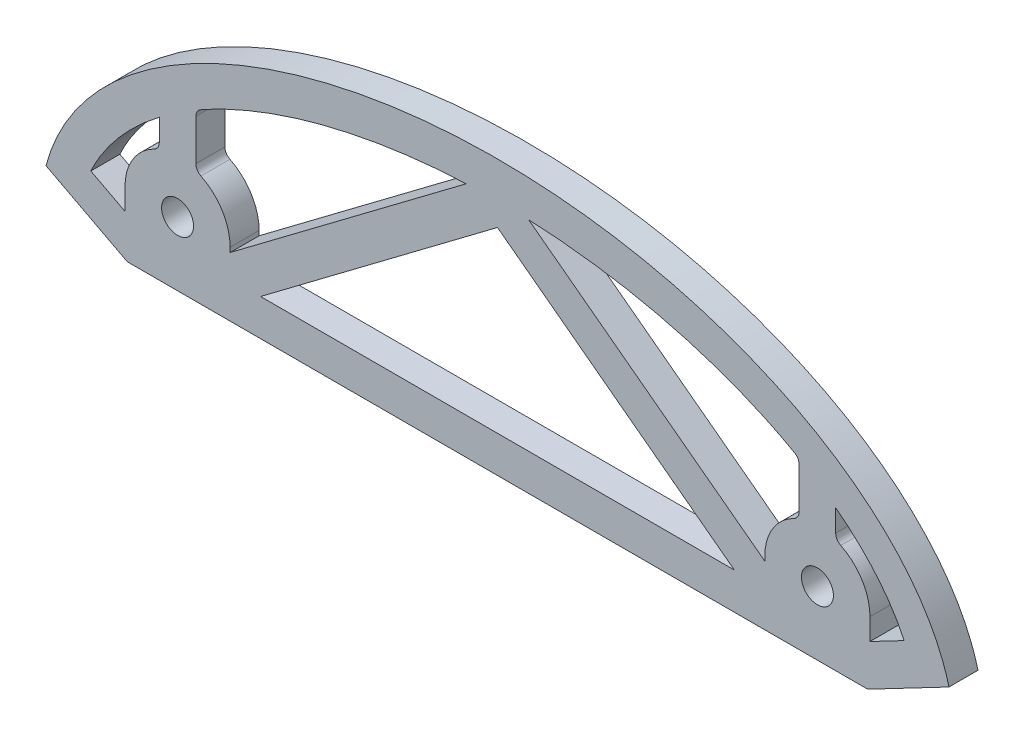
from build123d import *

# Parameters (mm, degrees)
SKETCH1_R               = 1.75
BOSS_EXTRUDE1_DEPTH     = 3.175
CUT_EXTRUDE2_DEPTH      = 104.871351997
CUT_EXTRUDE2_DEPTH_BACK = 104.871351997


with BuildPart() as part:
    # Sketch1 → Boss-Extrude1 (new body)
    with BuildSketch(Plane.XY):
        with BuildLine():
            Line((9.5, 0), (90.5, 0))
            Line((90.5, 0), (99.394049692, 4.65639644))
            add(Edge.make_bspline(
                [(99.394049692, 4.65639644), (92.757517889, 30), (50, 30), (7.242482111, 30), (0.605950308, 4.65639644)],
                knots=[3.309608299, 3.309608299, 3.309608299, 4.71238898, 4.71238898, 6.115169662, 6.115169662, 6.115169662], degree=2, weights=[0.94404498, 0.73843525, 1, 0.73843525, 0.94404498]))
            Line((0.605950308, 4.65639644), (9.5, 0))
        make_face()
        with Locations((15, 7)):
            Circle(SKETCH1_R, mode=Mode.SUBTRACT)
        with BuildLine():
            add(Edge.make_bspline(
                [(9.25, 12.062294005), (6.832522418, 9.453191203), (5.508863565, 6.604554423)],
                knots=[2.659161325, 2.659161325, 2.659161325, 2.884756952, 2.884756952, 2.884756952], degree=2, weights=[1, 0.993645069, 1]))
            Line((9.25, 12.062294005), (9.25, 4.645917471))
            Line((9.25, 4.645917471), (5.508863565, 6.604554423))
        make_face(mode=Mode.SUBTRACT)
        with Locations((85, 7)):
            Circle(SKETCH1_R, mode=Mode.SUBTRACT)
        with BuildLine():
            Line((90.75, 4.645917471), (90.75, 12.062294005))
            add(Edge.make_bspline(
                [(94.491136435, 6.604554423), (93.167477582, 9.453191203), (90.75, 12.062294005)],
                knots=[0.256835702, 0.256835702, 0.256835702, 0.482431329, 0.482431329, 0.482431329], degree=2, weights=[1, 0.993645069, 1]))
            Line((94.491136435, 6.604554423), (90.75, 4.645917471))
        make_face(mode=Mode.SUBTRACT)
        Polygon((75.922724168, 4), (24.077275832, 4), (50, 23.497433562), align=None, mode=Mode.SUBTRACT)
        with BuildLine():
            Line((79.25, 20.066709987), (79.25, 6.502566438))
            Line((79.25, 6.502566438), (53.42312279, 25.92790998))
            add(Edge.make_bspline(
                [(79.25, 20.066709987), (67.982150516, 25.313839283), (53.42312279, 25.92790998)],
                knots=[0.881661652, 0.881661652, 0.881661652, 1.499250046, 1.499250046, 1.499250046], degree=2, weights=[1, 0.897744364, 0.887128136]))
        make_face(mode=Mode.SUBTRACT)
        with BuildLine():
            add(Edge.make_bspline(
                [(46.57687721, 25.92790998), (32.017849484, 25.313839283), (20.75, 20.066709987)],
                knots=[1.642342608, 1.642342608, 1.642342608, 2.259931001, 2.259931001, 2.259931001], degree=2, weights=[0.887128136, 0.897744364, 1]))
            Line((46.57687721, 25.92790998), (20.75, 6.502566438))
            Line((20.75, 6.502566438), (20.75, 20.066709987))
        make_face(mode=Mode.SUBTRACT)
    extrude(amount=BOSS_EXTRUDE1_DEPTH)

    # Sketch2 → Cut-Extrude2 (cut, two sides: drawn at the far end of the back side and taken through both)
    with BuildSketch(Plane.XY.offset(3.175).offset(-CUT_EXTRUDE2_DEPTH_BACK)):
        with BuildLine():
            ThreePointArc((17.555555556, 12.150886895), (19.886560367, 10.030516091), (20.75, 7))
            Line((20.75, 7), (20.75, 20.066709987))
            add(Edge.make_bspline(
                [(20.75, 20.066709987), (19.05937684, 19.279433025), (17.508760006, 18.404916624)],
                knots=[5.400246246, 5.400246246, 5.400246246, 5.496691054, 5.496691054, 5.496691054], degree=2, weights=[0.985365434, 0.99153217, 1]))
            ThreePointArc((17.508760006, 18.404916624), (17.136507095, 18.038253345), (17, 17.53389236))
            Line((17, 17.53389236), (17, 13.046693311))
            ThreePointArc((17, 13.046693311), (17.150163414, 12.519647035), (17.555555556, 12.150886895))
        make_face()
        with BuildLine():
            add(Edge.make_bspline(
                [(13, 15.448126504), (10.894235227, 13.836862164), (9.25, 12.062294005)],
                knots=[5.646965989, 5.646965989, 5.646965989, 5.800753978, 5.800753978, 5.800753978], degree=2, weights=[1, 0.997045113, 1]))
            Line((9.25, 12.062294005), (9.25, 7))
            ThreePointArc((9.25, 7), (10.113439633, 10.030516091), (12.444444444, 12.150886895))
            ThreePointArc((12.444444444, 12.150886895), (12.849836586, 12.519647035), (13, 13.046693311))
            Line((13, 13.046693311), (13, 15.448126504))
        make_face()
        with BuildLine():
            Line((83, 13.046693311), (83, 17.53389236))
            ThreePointArc((83, 17.53389236), (82.863492905, 18.038253345), (82.491239994, 18.404916624))
            add(Edge.make_bspline(
                [(82.491239994, 18.404916624), (80.94062316, 19.279433025), (79.25, 20.066709987)],
                knots=[3.928086907, 3.928086907, 3.928086907, 4.024531715, 4.024531715, 4.024531715], degree=2, weights=[1, 0.99153217, 0.985365434]))
            Line((79.25, 20.066709987), (79.25, 7))
            ThreePointArc((79.25, 7), (80.113439633, 10.030516091), (82.444444444, 12.150886895))
            ThreePointArc((82.444444444, 12.150886895), (82.849836586, 12.519647035), (83, 13.046693311))
        make_face()
        with BuildLine():
            add(Edge.make_bspline(
                [(90.75, 12.062294005), (89.105764773, 13.836862164), (87, 15.448126504)],
                knots=[3.624023982, 3.624023982, 3.624023982, 3.777811972, 3.777811972, 3.777811972], degree=2, weights=[1, 0.997045113, 1]))
            Line((87, 15.448126504), (87, 13.046693311))
            ThreePointArc((87, 13.046693311), (87.150163414, 12.519647035), (87.555555556, 12.150886895))
            ThreePointArc((87.555555556, 12.150886895), (89.886560367, 10.030516091), (90.75, 7))
            Line((90.75, 7), (90.75, 12.062294005))
        make_face()
    extrude(amount=CUT_EXTRUDE2_DEPTH + CUT_EXTRUDE2_DEPTH_BACK, mode=Mode.SUBTRACT)


solid = part.part
